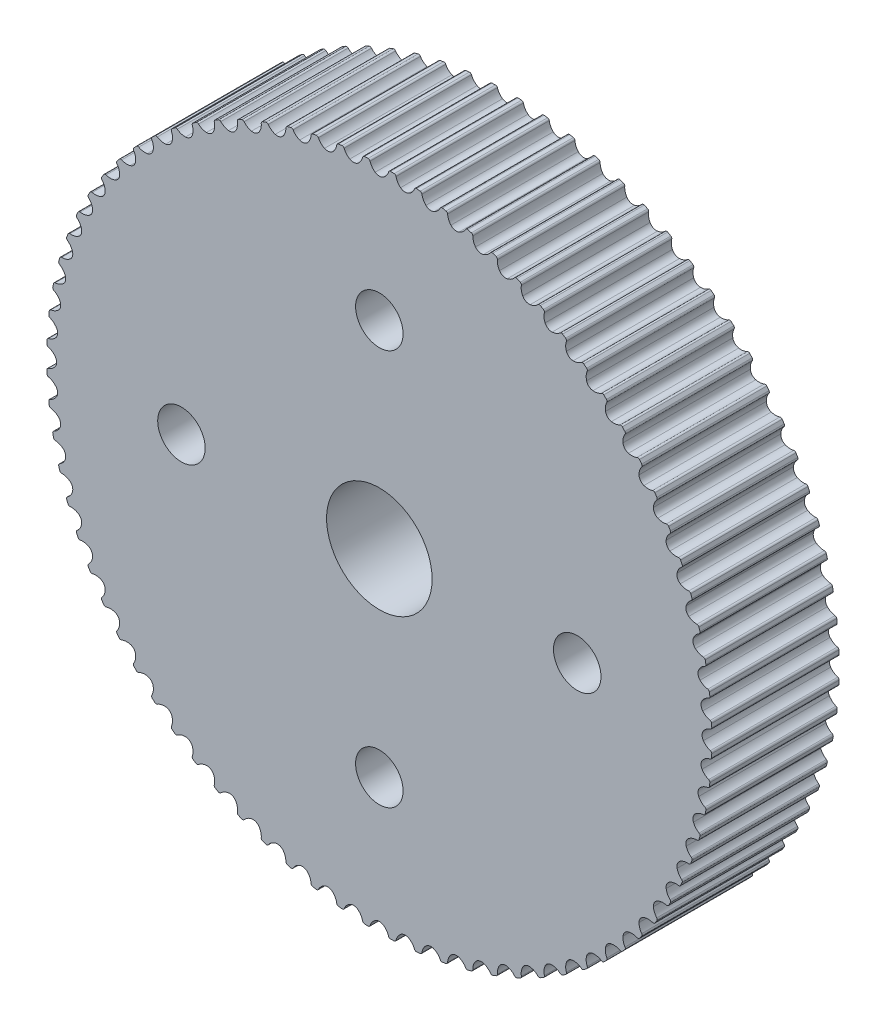
from build123d import *

# Parameters (mm, degrees)
CUT_EXTRUDE1_START   = 0.125
CUT_EXTRUDE1_DEPTH   = 38.027078607
CIRPATTERN1_COUNT    = 80
SKETCH4_R            = 2.0828
CUT_EXTRUDE2_DEPTH   = 37.88255206
CUT_EXTRUDE4_REACH   = 38.915
SKETCH12_R           = 19.05
M3_CLEARANCE_HOLE1_D = 3.6


with BuildPart() as part:
    # Sketch2 → Revolve1 (revolve)
    with BuildSketch(Plane(origin=(0, 0, 0), x_dir=(0, 0, -1), z_dir=(1, 0, 0)), mode=Mode.PRIVATE) as revolve1_sk:
        Polygon((-9.525, 4), (9.525, 4), (9.525, 25.2095), (-0.125, 25.2095), (-0.125, 19.05), (-9.525, 19.05), align=None)
    revolve(revolve1_sk.sketch.rotate(Axis((0, 0, 9.525), (0, 0, -1)), 90), axis=Axis((0, 0, 9.525), (0, 0, -1)))

    # Sketch3 → Cut-Extrude1 (cut, through all)
    with BuildSketch(Plane.XY.offset(CUT_EXTRUDE1_START)):
        with BuildLine():
            Line((1.998425863, 25.130164829), (2.047001303, 25.741))
            Line((2.047001303, 25.741), (-2.047001303, 25.741))
            Line((-2.047001303, 25.741), (-1.998425863, 25.130164829))
            ThreePointArc((-1.998425863, 25.130164829), (-1.425226771, 25.169179941), (-0.851287437, 25.195122543))
            ThreePointArc((-0.851287437, 25.195122543), (-0.758961833, 25.167214793), (-0.702714921, 25.088862101))
            ThreePointArc((-0.702714921, 25.088862101), (-0.554430072, 24.791296599), (-0.316786517, 24.558790331))
            ThreePointArc((-0.316786517, 24.558790331), (0, 24.4595), (0.316786517, 24.558790331))
            ThreePointArc((0.316786517, 24.558790331), (0.554430072, 24.791296599), (0.702714921, 25.088862101))
            ThreePointArc((0.702714921, 25.088862101), (0.758961833, 25.167214793), (0.851287437, 25.195122543))
            ThreePointArc((0.851287437, 25.195122543), (1.425226771, 25.169179941), (1.998425863, 25.130164829))
        make_face()
    cut_extrude1 = extrude(amount=-CUT_EXTRUDE1_DEPTH, mode=Mode.SUBTRACT)

    # CirPattern1: Cut-Extrude1 ×80 about axis
    cirpattern1_axis = Axis((0, 0, 0), (0, 0, 1))
    for i in range(1, CIRPATTERN1_COUNT):
        add(cut_extrude1.rotate(cirpattern1_axis, i * 360 / CIRPATTERN1_COUNT), mode=Mode.SUBTRACT)

    # Sketch4 → Cut-Extrude2 (cut, through all)
    with BuildSketch(Plane(origin=(0, 0, 0), x_dir=(0, 0, -1), z_dir=(1, 0, 0))):
        with Locations(Location((-4.825, 0, 0), (0, 0, 180.000000004))):
            Circle(SKETCH4_R)
    extrude(amount=CUT_EXTRUDE2_DEPTH, mode=Mode.SUBTRACT)

    # Sketch12 → Cut-Extrude4 (cut, up to next)
    with BuildSketch(Plane.XY.offset(0.125), mode=Mode.PRIVATE) as cut_extrude4_sk1:
        Circle(SKETCH12_R)
    cut_extrude4_tool1 = extrude(cut_extrude4_sk1.sketch, amount=CUT_EXTRUDE4_REACH, mode=Mode.PRIVATE) & part.part
    add(cut_extrude4_tool1.solids().sort_by_distance((0, 0, 0.125))[0], mode=Mode.SUBTRACT)

    # M3 Clearance Hole1 (through all)
    with Locations(Plane(origin=(0, 0, -9.525), x_dir=(-1, 0, 0), z_dir=(0, 0, -1))):
        with Locations((0, 15), (15, 0), (0, -15), (-15, 0)):
            Hole(M3_CLEARANCE_HOLE1_D / 2)


solid = part.part
